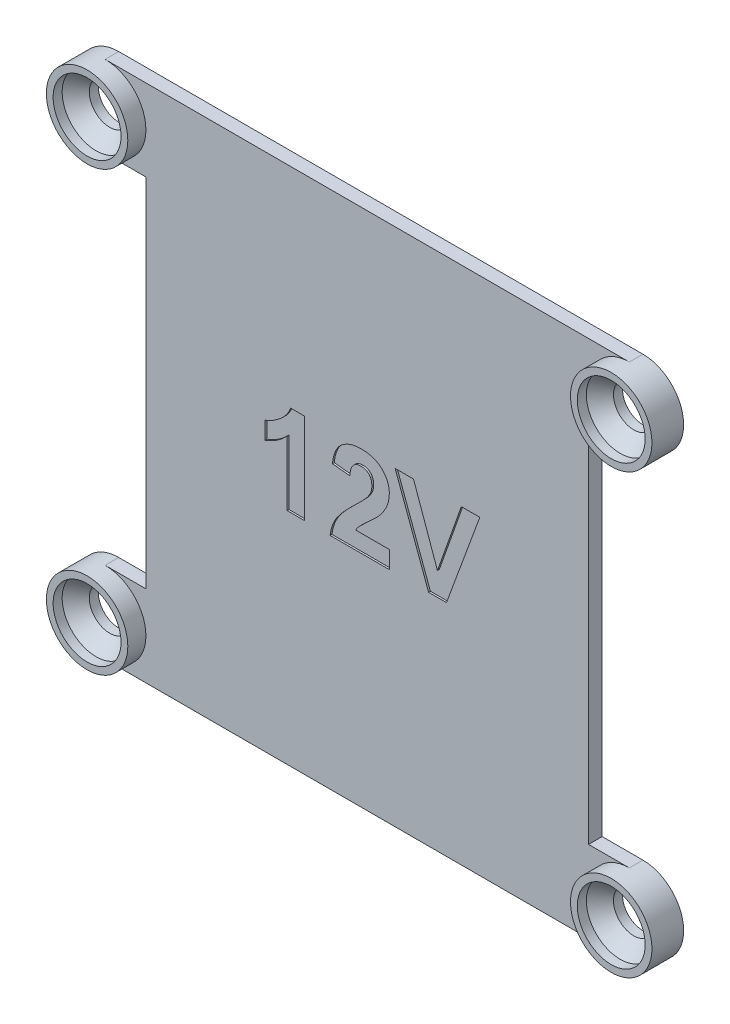
from build123d import *

# Parameters (mm, degrees)
SKETCH1_R           = 2.25
BOSS_EXTRUDE1_DEPTH = 1.5
SKETCH2_R           = 4.5
SKETCH2_R_2         = 2.25
BOSS_EXTRUDE2_DEPTH = 1
CHAMFER1_SIZE       = 1.5
SKETCH3_R           = 4.5
SKETCH3_R_2         = 3.75
BOSS_EXTRUDE3_DEPTH = 1
CUT_EXTRUDE1_DEPTH  = 0.2


with BuildPart() as part:
    # Sketch1 → Boss-Extrude1 (new body)
    with BuildSketch(Plane.XY):
        with BuildLine():
            ThreePointArc((-28.95, 28.7), (-33.45, 24.2), (-28.95, 19.7))
            Line((-28.95, 19.7), (-24.45, 19.7))
            Line((-24.45, 19.7), (-24.45, -19.7))
            Line((-24.45, -19.7), (-28.95, -19.7))
            ThreePointArc((-28.95, -19.7), (-33.45, -24.2), (-28.95, -28.7))
            Line((-28.95, -28.7), (28.95, -28.7))
            ThreePointArc((28.95, -28.7), (33.45, -24.2), (28.95, -19.7))
            Line((28.95, -19.7), (24.45, -19.7))
            Line((24.45, -19.7), (24.45, 19.7))
            Line((24.45, 19.7), (28.95, 19.7))
            ThreePointArc((28.95, 19.7), (33.45, 24.2), (28.95, 28.7))
            Line((28.95, 28.7), (-28.95, 28.7))
        make_face()
        with Locations((28.95, 24.2)):
            Circle(SKETCH1_R, mode=Mode.SUBTRACT)
        with Locations((28.95, -24.2)):
            Circle(SKETCH1_R, mode=Mode.SUBTRACT)
        with Locations((-28.95, -24.2)):
            Circle(SKETCH1_R, mode=Mode.SUBTRACT)
        with Locations((-28.95, 24.2)):
            Circle(SKETCH1_R, mode=Mode.SUBTRACT)
    extrude(amount=BOSS_EXTRUDE1_DEPTH)

    # Sketch2 → Boss-Extrude2 (add)
    # profile 1 of 4: a face of its own
    with BuildSketch(Plane.XY.offset(1.5)):
        with Locations((-28.95, 24.2)):
            Circle(SKETCH2_R)
        with Locations((-28.95, 24.2)):
            Circle(SKETCH2_R_2, mode=Mode.SUBTRACT)
    # profile 2 of 4: a face of its own
    with BuildSketch(Plane.XY.offset(1.5)):
        with Locations((28.95, 24.2)):
            Circle(SKETCH2_R)
        with Locations((28.95, 24.2)):
            Circle(SKETCH2_R_2, mode=Mode.SUBTRACT)
    # profile 3 of 4: a face of its own
    with BuildSketch(Plane.XY.offset(1.5)):
        with Locations((-28.95, -24.2)):
            Circle(SKETCH2_R)
        with Locations((-28.95, -24.2)):
            Circle(SKETCH2_R_2, mode=Mode.SUBTRACT)
    # profile 4 of 4: a face of its own
    with BuildSketch(Plane.XY.offset(1.5)):
        with Locations((28.95, -24.2)):
            Circle(SKETCH2_R)
        with Locations((28.95, -24.2)):
            Circle(SKETCH2_R_2, mode=Mode.SUBTRACT)
    extrude(amount=BOSS_EXTRUDE2_DEPTH)

    # Chamfer1
    chamfer1_edges = [part.edges().sort_by_distance(p)[0] for p in [
        (-31.2, -24.2, 2.5),
        (26.7, -24.2, 2.5),
        (26.7, 24.2, 2.5),
        (-31.2, 24.2, 2.5),
    ]]
    chamfer(chamfer1_edges, length=CHAMFER1_SIZE)

    # Sketch3 → Boss-Extrude3 (add)
    # profile 1 of 4: a face of its own
    with BuildSketch(Plane.XY.offset(2.5)):
        with Locations((-28.95, -24.2)):
            Circle(SKETCH3_R)
        with Locations((-28.95, -24.2)):
            Circle(SKETCH3_R_2, mode=Mode.SUBTRACT)
    # profile 2 of 4: a face of its own
    with BuildSketch(Plane.XY.offset(2.5)):
        with Locations((28.95, -24.2)):
            Circle(SKETCH3_R)
        with Locations((28.95, -24.2)):
            Circle(SKETCH3_R_2, mode=Mode.SUBTRACT)
    # profile 3 of 4: a face of its own
    with BuildSketch(Plane.XY.offset(2.5)):
        with Locations((28.95, 24.2)):
            Circle(SKETCH3_R)
        with Locations((28.95, 24.2)):
            Circle(SKETCH3_R_2, mode=Mode.SUBTRACT)
    # profile 4 of 4: a face of its own
    with BuildSketch(Plane.XY.offset(2.5)):
        with Locations((-28.95, 24.2)):
            Circle(SKETCH3_R)
        with Locations((-28.95, 24.2)):
            Circle(SKETCH3_R_2, mode=Mode.SUBTRACT)
    extrude(amount=BOSS_EXTRUDE3_DEPTH)

    # Sketch4 → Cut-Extrude1 (cut)
    with BuildSketch(Plane.XY.offset(1.5)):
        with BuildLine():
            Line((-6.923076923, -4.414458023), (-8.846153846, -4.414458023))
            Line((-8.846153846, -4.414458023), (-8.846153846, 2.704933003))
            add(Edge.make_bspline(
                [(-8.846153846, 2.704933003), (-8.933318023, 2.616445103), (-9.106463901, 2.440669737), (-9.383005145, 2.19548654), (-9.670097117, 1.967401521), (-9.970580856, 1.758581072), (-10.280528273, 1.566049869), (-10.603106853, 1.391327059), (-10.935978437, 1.231995104), (-11.166572995, 1.142953291), (-11.282051282, 1.09836249)],
                knots=[0, 0, 0, 0, 1.012567276, 2.011397996, 3.011400399, 4.000747768, 4.993445519, 5.985067596, 6.990952157, 8, 8, 8, 8], degree=3))
            Line((-11.282051282, 1.09836249), (-11.282051282, 3.021439413))
            add(Edge.make_bspline(
                [(-11.282051282, 3.021439413), (-11.153980048, 3.06946063), (-10.88593692, 3.1699653), (-10.490395403, 3.38374383), (-10.077539391, 3.648423218), (-9.730716774, 3.908012402), (-9.455353873, 4.138807932), (-9.26289614, 4.324331325), (-9.084572984, 4.514316902), (-8.927087219, 4.714896702), (-8.786304768, 4.922015444), (-8.661565378, 5.135334763), (-8.551766041, 5.355528522), (-8.494286856, 5.508866571), (-8.465544872, 5.585541977)],
                knots=[0, 0, 0, 0, 1.253673617, 2.623841347, 4.114270668, 5.751233548, 6.594491912, 7.409089316, 8.202422231, 8.983165545, 9.746111525, 10.498431446, 11.249153235, 12, 12, 12, 12], degree=3))
            Line((-8.465544872, 5.585541977), (-6.923076923, 5.585541977))
            Line((-6.923076923, 5.585541977), (-6.923076923, -4.414458023))
        make_face()
        with BuildLine():
            Line((2.435897436, -2.4913811), (2.435897436, -4.414458023))
            Line((2.435897436, -4.414458023), (-4.102564103, -4.414458023))
            add(Edge.make_bspline(
                [(-4.102564103, -4.414458023), (-4.080426387, -4.250103198), (-4.036163368, -3.921485704), (-3.899317938, -3.441458257), (-3.716676165, -2.973033485), (-3.518453211, -2.59184942), (-3.321298527, -2.285009365), (-3.142420071, -2.033582253), (-2.929024642, -1.766074598), (-2.684208836, -1.480326872), (-2.409325608, -1.175445832), (-2.102324151, -0.852564961), (-1.761740021, -0.513229981), (-1.522133018, -0.282804832), (-1.398237179, -0.163656741)],
                knots=[0, 0, 0, 0, 1.156289446, 2.311930546, 3.473459201, 4.661751613, 5.303057008, 6.018253237, 6.81459331, 7.690699809, 8.644447906, 9.679642995, 10.800191253, 12, 12, 12, 12], degree=3))
            add(Edge.make_bspline(
                [(-1.398237179, -0.163656741), (-1.299366883, -0.068219837), (-1.111146958, 0.113463921), (-0.843121421, 0.373627698), (-0.607499354, 0.612792158), (-0.399354228, 0.824759525), (-0.22349449, 1.014927025), (-0.077606865, 1.180308106), (0.040156295, 1.321576252), (0.103936924, 1.411196852), (0.132211538, 1.450926592)],
                knots=[0, 0, 0, 0, 1.480720495, 2.818855715, 4.024636094, 5.098235712, 6.019786162, 6.815086302, 7.474715479, 8, 8, 8, 8], degree=3))
            add(Edge.make_bspline(
                [(0.132211538, 1.450926592), (0.190111047, 1.547103861), (0.30179249, 1.73261867), (0.424260458, 2.024344061), (0.497770298, 2.316009192), (0.507857836, 2.510898163), (0.512820513, 2.606775951)],
                knots=[0, 0, 0, 0, 1.0911822, 2.104764037, 3.067617678, 4, 4, 4, 4], degree=3))
            add(Edge.make_bspline(
                [(0.512820513, 2.606775951), (0.509218846, 2.70654968), (0.502404775, 2.895313794), (0.445267605, 3.161694863), (0.343944107, 3.390687129), (0.204440295, 3.582993487), (0.028037447, 3.733664782), (-0.178182613, 3.844996243), (-0.417238616, 3.906548032), (-0.585261277, 3.914644013), (-0.673076923, 3.91887531)],
                knots=[0, 0, 0, 0, 1.193122327, 2.257294386, 3.237245624, 4.168877528, 5.075331632, 5.990371598, 6.949684428, 8, 8, 8, 8], degree=3))
            add(Edge.make_bspline(
                [(-0.673076923, 3.91887531), (-0.760299295, 3.914923595), (-0.928794085, 3.907289734), (-1.168261741, 3.840601371), (-1.377751743, 3.7251568), (-1.52704546, 3.593596575), (-1.627900447, 3.465663812), (-1.696619517, 3.354178836), (-1.755849991, 3.227497715), (-1.808333132, 3.087046666), (-1.84978888, 2.931216675), (-1.883174765, 2.761194545), (-1.910078959, 2.576065314), (-1.918634967, 2.447276207), (-1.923076923, 2.380413772)],
                knots=[0, 0, 0, 0, 1.402788338, 2.709884207, 3.961032948, 5.225417836, 5.883680772, 6.578928686, 7.329201998, 8.132101139, 8.990263233, 9.922304639, 10.921339128, 12, 12, 12, 12], degree=3))
            Line((-1.923076923, 2.380413772), (-3.846153846, 2.568715054))
            add(Edge.make_bspline(
                [(-3.846153846, 2.568715054), (-3.830692606, 2.698546985), (-3.80071573, 2.950270356), (-3.725907936, 3.311831909), (-3.631166636, 3.645388763), (-3.511975194, 3.950321896), (-3.373259936, 4.228570387), (-3.207945231, 4.475958944), (-3.021807349, 4.695227932), (-2.814685425, 4.886260652), (-2.5878962, 5.049664829), (-2.349921603, 5.195528131), (-2.096110944, 5.315182407), (-1.829258686, 5.413795508), (-1.549485425, 5.49260631), (-1.255497172, 5.544714943), (-0.949108314, 5.581368356), (-0.739966, 5.584129802), (-0.633012821, 5.585541977)],
                knots=[0, 0, 0, 0, 1.270971563, 2.464210789, 3.586263665, 4.638946707, 5.643716971, 6.603612468, 7.52484387, 8.434700188, 9.336036235, 10.239171475, 11.145359471, 12.059630629, 13.003312604, 13.96741569, 14.960557767, 16, 16, 16, 16], degree=3))
            add(Edge.make_bspline(
                [(-0.633012821, 5.585541977), (-0.516740897, 5.583307291), (-0.290286727, 5.57895496), (0.040296159, 5.543013371), (0.350855029, 5.480344005), (0.644105005, 5.397329559), (0.917034567, 5.286499204), (1.171918028, 5.152509913), (1.404743968, 4.990276522), (1.618982973, 4.808646307), (1.810495503, 4.608911963), (1.978243149, 4.395861516), (2.118781575, 4.169643399), (2.236714897, 3.93301496), (2.324279592, 3.682168505), (2.388083037, 3.420572552), (2.43038729, 3.147006702), (2.434040407, 2.960167431), (2.435897436, 2.865189413)],
                knots=[0, 0, 0, 0, 1.210756838, 2.35810096, 3.457354827, 4.507168606, 5.527358126, 6.519769748, 7.499700793, 8.476517721, 9.440526811, 10.376769937, 11.295256217, 12.209626307, 13.124630862, 14.055668209, 15.011616881, 16, 16, 16, 16], degree=3))
            add(Edge.make_bspline(
                [(2.435897436, 2.865189413), (2.433450826, 2.756184824), (2.428597126, 2.539936446), (2.382126554, 2.220256739), (2.311128567, 1.907948806), (2.206199134, 1.602249395), (2.073192931, 1.295825486), (1.901744746, 0.987989283), (1.702680436, 0.669456993), (1.546820928, 0.463511968), (1.466346154, 0.357176592)],
                knots=[0, 0, 0, 0, 0.953409949, 1.89141903, 2.821310783, 3.752688675, 4.715703262, 5.740811754, 6.833515735, 8, 8, 8, 8], degree=3))
            add(Edge.make_bspline(
                [(1.466346154, 0.357176592), (1.435930222, 0.318867637), (1.370786347, 0.236818733), (1.259959496, 0.111009427), (1.131520709, -0.026413994), (0.987284126, -0.178023781), (0.82248533, -0.338451015), (0.643053791, -0.51440464), (0.441093999, -0.696884043), (0.231912595, -0.890441198), (0.021821946, -1.078827655), (-0.171281651, -1.257753025), (-0.34668397, -1.416063548), (-0.496216198, -1.562498691), (-0.628673782, -1.687064362), (-0.739282513, -1.796148144), (-0.830112141, -1.887109206), (-0.955269523, -2.028894425), (-1.114518089, -2.220658992), (-1.226555966, -2.40389546), (-1.280048077, -2.4913811)],
                knots=[0, 0, 0, 0, 0.665555651, 1.425465941, 2.280616993, 3.225313414, 4.272635571, 5.410053715, 6.644756443, 7.976022804, 9.288331007, 10.484517221, 11.558462543, 12.503158964, 13.33222979, 14.032602617, 14.617328242, 15.080653724, 16.606167857, 18, 18, 18, 18], degree=3))
            Line((-1.280048077, -2.4913811), (2.435897436, -2.4913811))
        make_face()
        Polygon((6.774839744, -4.414458023), (3.076923077, 5.585541977), (5.108173077, 5.585541977), (7.756410256, -1.850355459), (10.39463141, 5.585541977), (12.435897436, 5.585541977), (8.752003205, -4.414458023), align=None)
    extrude(amount=-CUT_EXTRUDE1_DEPTH, mode=Mode.SUBTRACT)


solid = part.part
